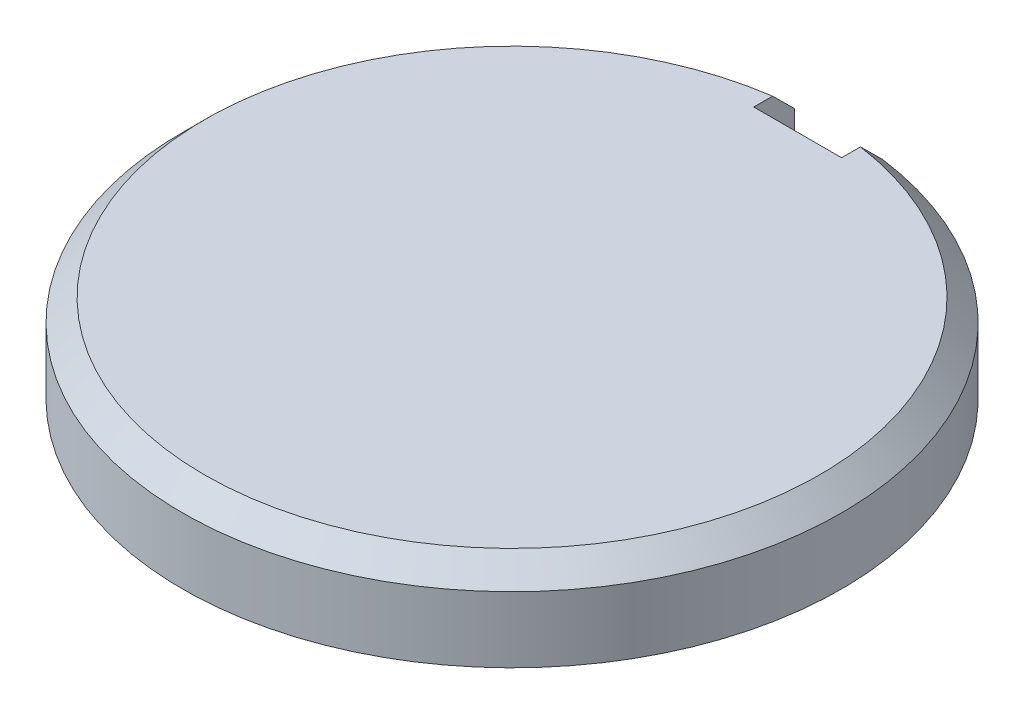
from build123d import *

# Parameters (mm, degrees)
BOSS_EXTRUDE1_START = -65.2
SKETCH2_W           = 0.8
SKETCH2_H           = 1.28
BOSS_EXTRUDE1_DEPTH = 6.4
BOSS_EXTRUDE2_START = -62.4
SKETCH3_W           = 6.4
SKETCH3_H           = 1.28
BOSS_EXTRUDE2_DEPTH = 0.8
BOSS_EXTRUDE3_START = -68.1
SKETCH4_W           = 1.6
SKETCH4_H           = 1.8
BOSS_EXTRUDE3_DEPTH = 0.9


with BuildPart() as part:
    # Sketch1 → Revolve1 (revolve)
    with BuildSketch(Plane.XY.offset(-62)):
        Polygon((2.3, 49.6), (2.3, 50.6), (0, 50.6), (0, 52.2), (5.6, 52.2), (6, 51.8), (6, 50.6), (3, 50.6), (3, 49.6), align=None)
    revolve(axis=Axis((0, 44.6, -62), (0, 1, 0)))


with BuildPart() as body_2:
    # Sketch2 → Boss-Extrude1 (new body)
    with BuildSketch(Plane.XY.offset(BOSS_EXTRUDE1_START)):
        with Locations((0, 49.94)):
            Rectangle(SKETCH2_W, SKETCH2_H)
    extrude(amount=BOSS_EXTRUDE1_DEPTH)


with BuildPart() as part_1:
    add(part.part)

    # Combine1: cut body 2
    add(body_2.part, mode=Mode.SUBTRACT)


with BuildPart() as body_2_2:
    # Sketch3 → Boss-Extrude2 (new body)
    with BuildSketch(Plane.XY.offset(BOSS_EXTRUDE2_START)):
        with Locations((0, 49.94)):
            Rectangle(SKETCH3_W, SKETCH3_H)
    extrude(amount=BOSS_EXTRUDE2_DEPTH)


with BuildPart() as part_2:
    add(part_1.part)

    # Combine2: cut body 2 2
    add(body_2_2.part, mode=Mode.SUBTRACT)


with BuildPart() as body_2_3:
    # Sketch4 → Boss-Extrude3 (new body)
    with BuildSketch(Plane.XY.offset(BOSS_EXTRUDE3_START)):
        with Locations((0, 51.4)):
            Rectangle(SKETCH4_W, SKETCH4_H)
    extrude(amount=BOSS_EXTRUDE3_DEPTH)


with BuildPart() as part_3:
    add(part_2.part)

    # Combine3: cut body 2 3
    add(body_2_3.part, mode=Mode.SUBTRACT)


solid = part_3.part
